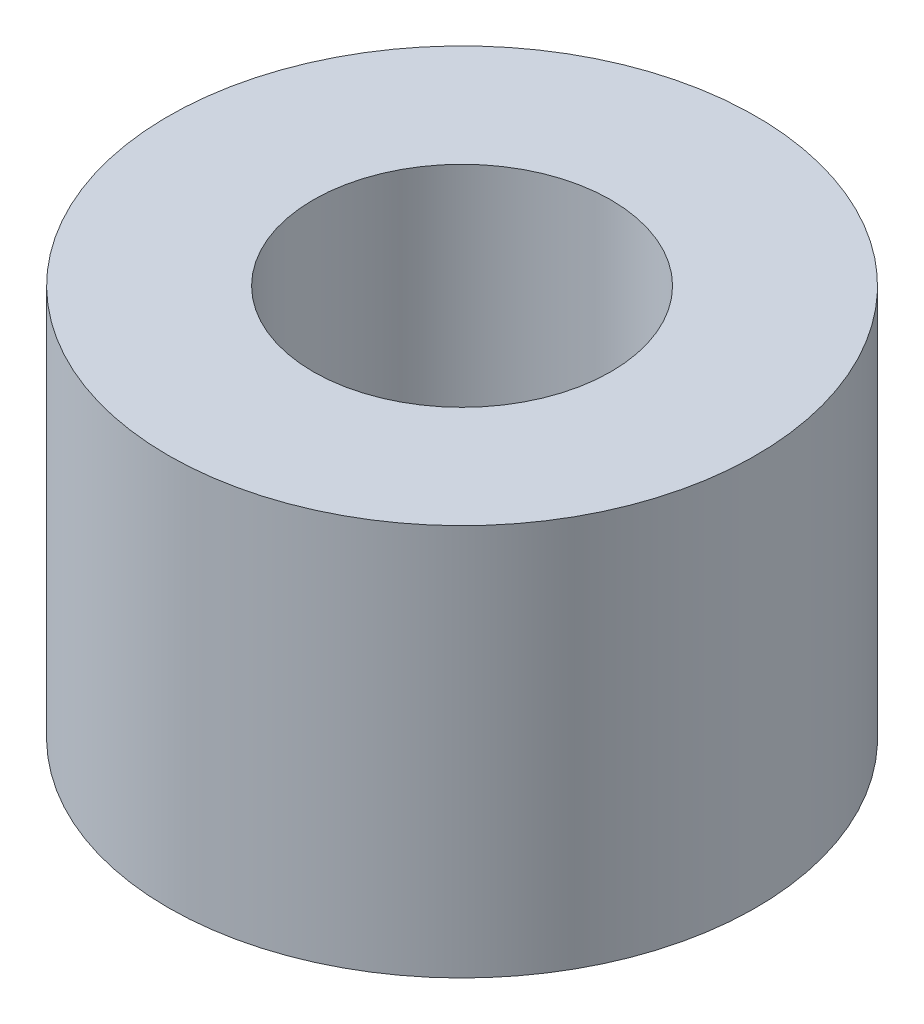
from build123d import *

# Parameters (mm, degrees)
SKETCH1_R           = 4.7625
SKETCH1_R_2         = 2.413
BOSS_EXTRUDE1_DEPTH = 6.35


with BuildPart() as part:
    # Sketch1 → Boss-Extrude1 (new body)
    with BuildSketch(Plane(origin=(0, 0, 0), x_dir=(1, 0, 0), z_dir=(0, 1, 0))):
        Circle(SKETCH1_R)
        Circle(SKETCH1_R_2, mode=Mode.SUBTRACT)
    extrude(amount=BOSS_EXTRUDE1_DEPTH)


solid = part.part
